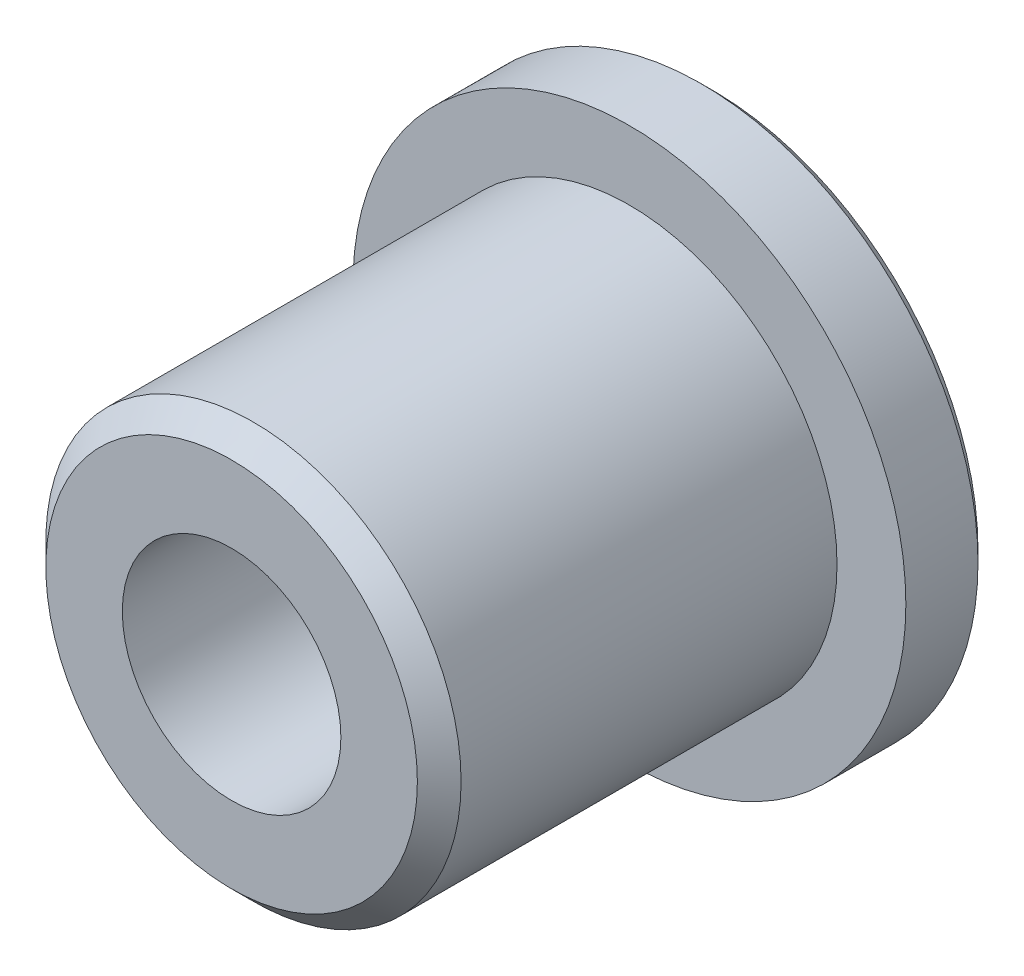
from build123d import *

# Parameters (mm, degrees)
SKETCH_1_R          = 12.65
SKETCH_1_R_2        = 5.875
EXTRUDE_1_DEPTH     = 2
SKETCH_2_R          = 9.5
SKETCH_2_R_2        = 5
EXTRUDE_2_DEPTH     = 20
CHAMFER_1_SIZE      = 0.5
SKETCH_3_R          = 12.65
SKETCH_3_R_2        = 9.5
EXTRUDE_3_DEPTH     = 1.8
CHAMFER_2_SIZE      = 1
CHAMFER_4_SIZE      = 0.5
SKETCH_4_R          = 5
SKETCH_4_R_2        = 3
EXTRUDE_4_DEPTH     = 2
SKETCH_7_R          = 5.9
CUT_EXTRUDE_1_DEPTH = 0.3
CHAMFER_5_SIZE      = 0.5
SKETCH_8_R          = 3.25
CUT_EXTRUDE_2_DEPTH = 0.6
CHAMFER_6_SIZE      = 0.5


with BuildPart() as part:
    # 스케치1 → 보스-돌출1 (new body)
    with BuildSketch(Plane.XY):
        Circle(SKETCH_1_R)
        Circle(SKETCH_1_R_2, mode=Mode.SUBTRACT)
    extrude(amount=EXTRUDE_1_DEPTH)

    # 스케치2 → 보스-돌출2 (add)
    with BuildSketch(Plane.XY.offset(2)):
        Circle(SKETCH_2_R)
        Circle(SKETCH_2_R_2, mode=Mode.SUBTRACT)
    extrude(amount=EXTRUDE_2_DEPTH)

    # 모따기1
    chamfer_1_edges = [part.edges().sort_by_distance(p)[0] for p in [
        (-5.875, 0, 0),
    ]]
    chamfer(chamfer_1_edges, length=CHAMFER_1_SIZE)

    # 스케치3 → 보스-돌출3 (add)
    with BuildSketch(Plane.XY.offset(2)):
        Circle(SKETCH_3_R)
        Circle(SKETCH_3_R_2, mode=Mode.SUBTRACT)
    extrude(amount=EXTRUDE_3_DEPTH)

    # 모따기2
    chamfer_2_edges = [part.edges().sort_by_distance(p)[0] for p in [
        (-9.5, 0, 22),
    ]]
    chamfer(chamfer_2_edges, length=CHAMFER_2_SIZE)

    # 모따기4
    chamfer_4_edges = [part.edges().sort_by_distance(p)[0] for p in [
        (-12.65, 0, 0),
    ]]
    chamfer(chamfer_4_edges, length=CHAMFER_4_SIZE)

    # 스케치4 → 보스-돌출4 (add)
    with BuildSketch(Plane(origin=(0, 0, 2), x_dir=(-1, 0, 0), z_dir=(0, 0, -1))):
        Circle(SKETCH_4_R)
        Circle(SKETCH_4_R_2, mode=Mode.SUBTRACT)
    extrude(amount=-EXTRUDE_4_DEPTH)

    # 스케치7 → 컷-돌출1 (cut)
    with BuildSketch(Plane(origin=(0, 0, 2), x_dir=(-1, 0, 0), z_dir=(0, 0, -1))):
        Circle(SKETCH_7_R)
    extrude(amount=-CUT_EXTRUDE_1_DEPTH, mode=Mode.SUBTRACT)

    # 모따기5
    chamfer_5_edges = [part.edges().sort_by_distance(p)[0] for p in [
        (3, 0, 2.3),
    ]]
    chamfer(chamfer_5_edges, length=CHAMFER_5_SIZE)

    # 스케치8 → 컷-돌출2 (cut)
    with BuildSketch(Plane.XY.offset(4)):
        Circle(SKETCH_8_R)
    extrude(amount=-CUT_EXTRUDE_2_DEPTH, mode=Mode.SUBTRACT)

    # 모따기6
    # the kernel refuses this chamfer: 0.5 mm, written as the material it adds along each edge
    with BuildSketch(Plane(origin=(0, 0, 3.4), x_dir=(1, 0, 0), z_dir=(0, -1, 0))) as chamfer_6_piece_1_section:
        Polygon((3.25 - CHAMFER_6_SIZE, 0), (3.25, CHAMFER_6_SIZE), (3.25, 0), align=None)
    chamfer_6_piece_1 = revolve(axis=Axis((0, 0, 3.4), (0, 0, 1)), mode=Mode.PRIVATE)
    chamfer_6_piece_1 = chamfer_6_piece_1 - Plane(origin=(0, 0, 3.773130842), x_dir=(-1, 0, 0), z_dir=(0, 0, -1)) * Cylinder(3, 13, mode=Mode.PRIVATE)
    add(chamfer_6_piece_1)


solid = part.part
